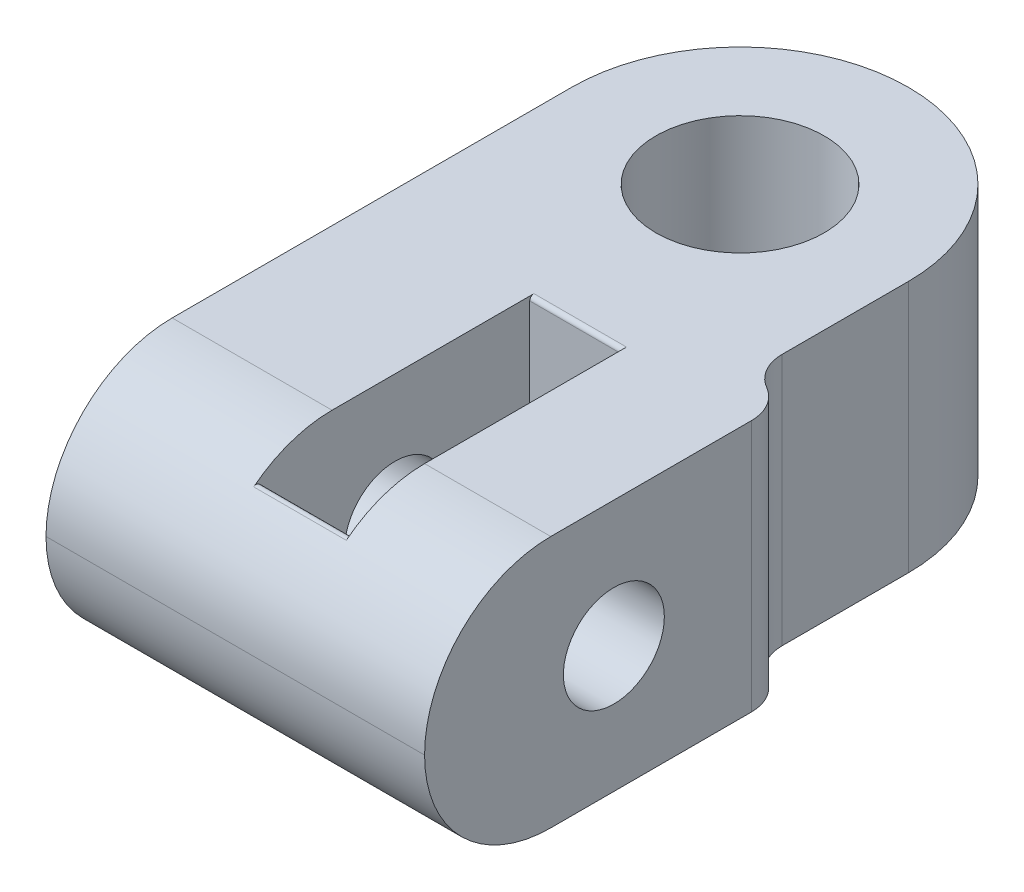
from build123d import *

# Parameters (mm, degrees)
SKETCH1_R           = 2.54
BOSS_EXTRUDE1_DEPTH = 7.62
SKETCH2_R           = 1.524
CUT_EXTRUDE1_DEPTH  = 21.993449574
FILLET1_R           = 5.08
FILLET4_R           = 3.81
FILLET2_R           = 1.27
FILLET3_R           = 1.27
SKETCH3_W           = 2.794
SKETCH3_H           = 8.128
CUT_EXTRUDE2_DEPTH  = 19.719041935
FILLET5_R           = 0.127


with BuildPart() as part:
    # Sketch1 → Boss-Extrude1 (new body)
    with BuildSketch(Plane(origin=(0, 0, 0), x_dir=(1, 0, 0), z_dir=(0, 1, 0))):
        Polygon((-5.08, 5.08), (5.08, 5.08), (5.08, -5.08), (6.35, -5.08), (6.35, -15.875), (-5.08, -15.875), align=None)
        with Locations(Location((0, 0, 0), (0, 0, 270))):
            Circle(SKETCH1_R, mode=Mode.SUBTRACT)
    extrude(amount=BOSS_EXTRUDE1_DEPTH)

    # Sketch2 → Cut-Extrude1 (cut, through all)
    with BuildSketch(Plane(origin=(6.35, 0, 0), x_dir=(0, 0, -1), z_dir=(1, 0, 0))):
        with Locations((-10.16, 3.81)):
            Circle(SKETCH2_R)
    extrude(amount=-CUT_EXTRUDE1_DEPTH, mode=Mode.SUBTRACT)

    # Fillet1
    fillet1_edges = [part.edges().sort_by_distance(p)[0] for p in [
        (-5.08, 3.81, -5.08),
        (5.08, 3.81, -5.08),
    ]]
    fillet(fillet1_edges, radius=FILLET1_R - 0.0001)  # a hair under: the kernel refuses the full size

    # Fillet4
    fillet4_edges = [part.edges().sort_by_distance(p)[0] for p in [
        (0.635, 0, 15.875),
        (0.635, 7.62, 15.875),
    ]]
    fillet(fillet4_edges, radius=FILLET4_R - 0.0001)  # a hair under: the kernel refuses the full size

    # Fillet2
    fillet2_edges = [part.edges().sort_by_distance(p)[0] for p in [
        (5.08, 3.81, 5.08),
    ]]
    fillet(fillet2_edges, radius=FILLET2_R - 0.0001)  # a hair under: the kernel refuses the full size

    # Fillet3
    fillet3_edges = [part.edges().sort_by_distance(p)[0] for p in [
        (6.35, 3.81, 5.08),
    ]]
    fillet(fillet3_edges, radius=FILLET3_R)

    # Sketch3 → Cut-Extrude2 (cut, through all)
    with BuildSketch(Plane(origin=(0, 7.62, 0), x_dir=(1, 0, 0), z_dir=(0, 1, 0))):
        with Locations((1.143, -10.16)):
            Rectangle(SKETCH3_W, SKETCH3_H)
    extrude(amount=-CUT_EXTRUDE2_DEPTH, mode=Mode.SUBTRACT)

    # Fillet5
    fillet5_edges = [part.edges().sort_by_distance(p)[0] for p in [
        (1.143, 0.670713991, 14.224),
        (1.143, 7.62, 6.096),
        (1.143, 6.949286009, 14.224),
        (1.143, 0, 6.096),
    ]]
    fillet(fillet5_edges, radius=FILLET5_R)


solid = part.part
